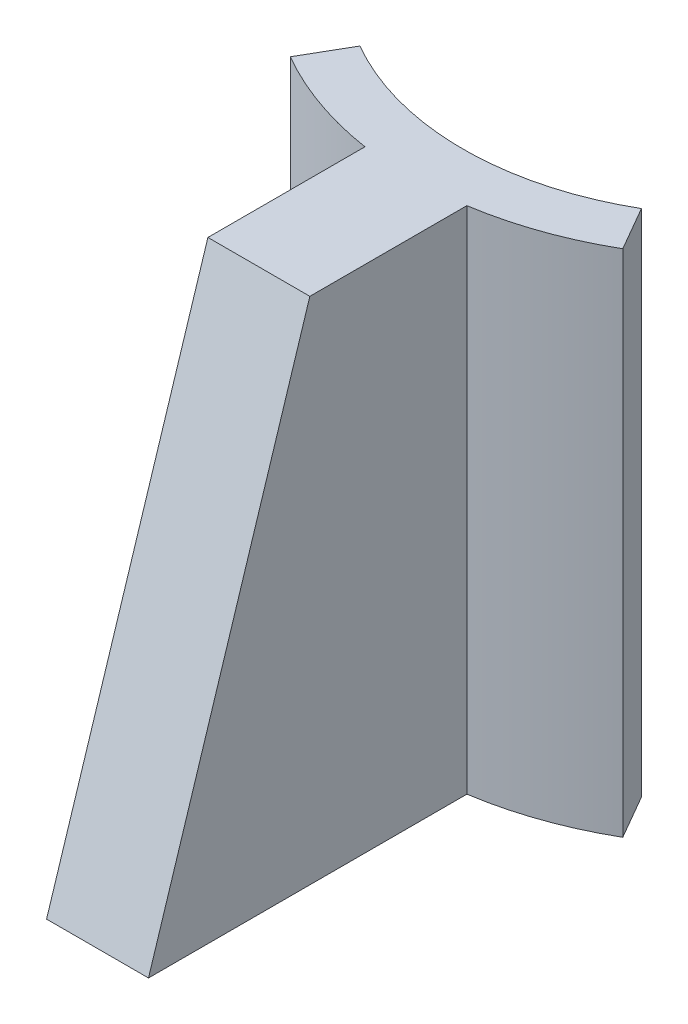
from build123d import *

# Parameters (mm, degrees)
BOSS_EXTRUDE1_DEPTH      = 0.5
BOSS_EXTRUDE1_DEPTH_BACK = 0.5
BOSS_EXTRUDE2_DEPTH      = 2.5
BOSS_EXTRUDE2_DEPTH_BACK = 2.5
SCALE2_SCALE             = 10


with BuildPart() as part:
    # Sketch1 → Boss-Extrude1 (new, two sides: drawn at the far end of the back side and taken through both)
    with BuildSketch(Plane(origin=(0, 0, 0), x_dir=(0, 0, -1), z_dir=(1, 0, 0)).offset(-BOSS_EXTRUDE1_DEPTH_BACK)):
        Polygon((-2.836617921, 9), (-3.261901286, 9), (-4.763807052, 9), (-6.346474592, 4), (-3.261901286, 4), (-2.836617921, 4), align=None)
    extrude(amount=BOSS_EXTRUDE1_DEPTH + BOSS_EXTRUDE1_DEPTH_BACK)

    # Sketch2 → Boss-Extrude2 (add, two sides: drawn at the far end of the back side and taken through both)
    with BuildSketch(Plane(origin=(0, 6.5, 0), x_dir=(1, 0, 0), z_dir=(0, 1, 0)).offset(-BOSS_EXTRUDE2_DEPTH_BACK)):
        with BuildLine():
            Line((-1.380950907, -2.391876524), (-1.630950928, -2.824889214))
            ThreePointArc((-1.630950928, -2.824889214), (-0.844242346, -3.150754649), (-2.4e-08, -3.261901286))
            ThreePointArc((-2.4e-08, -3.261901286), (0.8442423, -3.150754662), (1.630950886, -2.824889238))
            Line((1.630950886, -2.824889238), (1.380950907, -2.391876524))
            ThreePointArc((1.380950907, -2.391876524), (0.714832801, -2.667791742), (0, -2.761901286))
            ThreePointArc((0, -2.761901286), (-0.714832801, -2.667791742), (-1.380950907, -2.391876524))
        make_face()
    extrude(amount=BOSS_EXTRUDE2_DEPTH + BOSS_EXTRUDE2_DEPTH_BACK)


with BuildPart() as part_1:
    # Scale2: scaled about (0, 0, 0)
    add(part.part.scale(SCALE2_SCALE))


solid = part_1.part
